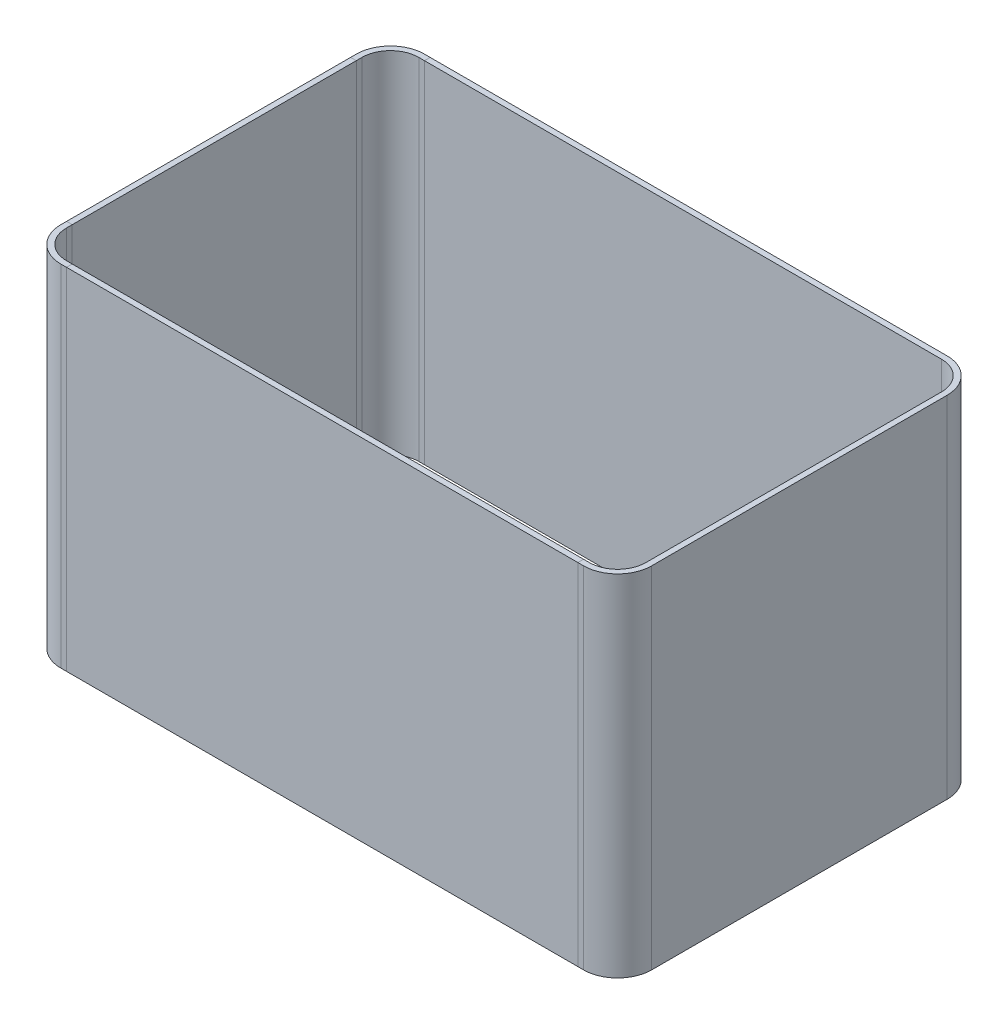
from build123d import *

# Parameters (mm, degrees)
BOSS_EXTRUDE1_DEPTH      = 180.8
BOSS_EXTRUDE1_DEPTH_BACK = 4
SPLIT1_START             = -4
SPLIT1_OUTLINE_W         = 270
SPLIT1_OUTLINE_H         = 3
SPLIT1_DEPTH             = 184.8
SPLIT1_2_OUTLINE_W       = 3
SPLIT1_2_OUTLINE_H       = 150
SPLIT1_2_DEPTH           = 184.8
SPLIT1_3_DEPTH           = 184.8
SPLIT1_4_DEPTH           = 184.8
SPLIT1_START_2           = -156
SPLIT1_5_OUTLINE_W       = 184.8
SPLIT1_5_OUTLINE_H       = 189
SPLIT1_5_DEPTH           = 291
SPLIT1_START_3           = -151.250554839
SPLIT1_6_OUTLINE_W       = 184.8
SPLIT1_6_OUTLINE_H       = 3
SPLIT1_6_DEPTH           = 16.250554839


# Read off the part's stored shape, not the designer's step: Split1
with BuildPart() as part:
    # Sketch1 → Boss-Extrude1 (new, two sides: drawn at the far end of the back side and taken through both)
    with BuildSketch(Plane(origin=(0, 0, 0), x_dir=(1, 0, 0), z_dir=(0, 1, 0)).offset(-BOSS_EXTRUDE1_DEPTH_BACK)):
        with BuildLine():
            Line((-156, 78), (-156, -78))
            ThreePointArc((-156, -78), (-150.727922061, -90.727922061), (-138, -96))
            Line((-138, -96), (138, -96))
            ThreePointArc((138, -96), (150.727922061, -90.727922061), (156, -78))
            Line((156, -78), (156, 78))
            ThreePointArc((156, 78), (150.727922061, 90.727922061), (138, 96))
            Line((138, 96), (-138, 96))
            ThreePointArc((-138, 96), (-150.727922061, 90.727922061), (-156, 78))
        make_face()
        with BuildLine():
            Line((-138, 93), (138, 93))
            ThreePointArc((138, 93), (148.606601718, 88.606601718), (153, 78))
            Line((153, 78), (153, -78))
            ThreePointArc((153, -78), (148.606601718, -88.606601718), (138, -93))
            Line((138, -93), (-138, -93))
            ThreePointArc((-138, -93), (-148.606601718, -88.606601718), (-153, -78))
            Line((-153, -78), (-153, 78))
            ThreePointArc((-153, 78), (-148.606601718, 88.606601718), (-138, 93))
        make_face(mode=Mode.SUBTRACT)
    extrude(amount=BOSS_EXTRUDE1_DEPTH + BOSS_EXTRUDE1_DEPTH_BACK)

    # Split1 5 outline → Split1 5 (cut)
    with BuildSketch(Plane.YZ.offset(SPLIT1_START_2)):
        with Locations((88.4, 1.5)):
            Rectangle(SPLIT1_5_OUTLINE_W, SPLIT1_5_OUTLINE_H)
    extrude(amount=SPLIT1_5_DEPTH, mode=Mode.SUBTRACT)

    # Split1 6 outline → Split1 6 (cut)
    with BuildSketch(Plane.YZ.offset(SPLIT1_START_3)):
        with Locations((88.4, -94.5)):
            Rectangle(SPLIT1_6_OUTLINE_W, SPLIT1_6_OUTLINE_H)
    extrude(amount=SPLIT1_6_DEPTH, mode=Mode.SUBTRACT)


with BuildPart() as body_2:
    # Split1 outline → Split1 (new body)
    with BuildSketch(Plane(origin=(0, 0, 0), x_dir=(1, 0, 0), z_dir=(0, 1, 0)).offset(SPLIT1_START)):
        with Locations((0, -94.5)):
            Rectangle(SPLIT1_OUTLINE_W, SPLIT1_OUTLINE_H)
    extrude(amount=SPLIT1_DEPTH)


with BuildPart() as body_3:
    # Split1 2 outline → Split1 2 (new body)
    with BuildSketch(Plane(origin=(0, 0, 0), x_dir=(1, 0, 0), z_dir=(0, 1, 0)).offset(SPLIT1_START)):
        with Locations((-154.5, 0)):
            Rectangle(SPLIT1_2_OUTLINE_W, SPLIT1_2_OUTLINE_H)
    extrude(amount=SPLIT1_2_DEPTH)


with BuildPart() as body_4:
    # Split1 3 outline → Split1 3 (new body)
    with BuildSketch(Plane(origin=(0, 0, 0), x_dir=(1, 0, 0), z_dir=(0, 1, 0)).offset(SPLIT1_START)):
        with BuildLine():
            Line((-138, 93), (-135, 93))
            Line((-135, 93), (-135, 96))
            Line((-135, 96), (-138, 96))
            ThreePointArc((-138, 96), (-150.727922061, 90.727922061), (-156, 78))
            Line((-156, 78), (-156, 75))
            Line((-156, 75), (-153, 75))
            Line((-153, 75), (-153, 78))
            ThreePointArc((-153, 78), (-148.606601718, 88.606601718), (-138, 93))
        make_face()
    extrude(amount=SPLIT1_3_DEPTH)


with BuildPart() as body_5:
    # Split1 4 outline → Split1 4 (new body)
    with BuildSketch(Plane(origin=(0, 0, 0), x_dir=(1, 0, 0), z_dir=(0, 1, 0)).offset(SPLIT1_START)):
        with BuildLine():
            Line((-138, -96), (-135, -96))
            Line((-135, -96), (-135, -93))
            Line((-135, -93), (-138, -93))
            ThreePointArc((-138, -93), (-148.606601718, -88.606601718), (-153, -78))
            Line((-153, -78), (-153, -75))
            Line((-153, -75), (-156, -75))
            Line((-156, -75), (-156, -78))
            ThreePointArc((-156, -78), (-150.727922061, -90.727922061), (-138, -96))
        make_face()
    extrude(amount=SPLIT1_4_DEPTH)


solid = Compound([part.part, body_2.part, body_3.part, body_4.part, body_5.part])
